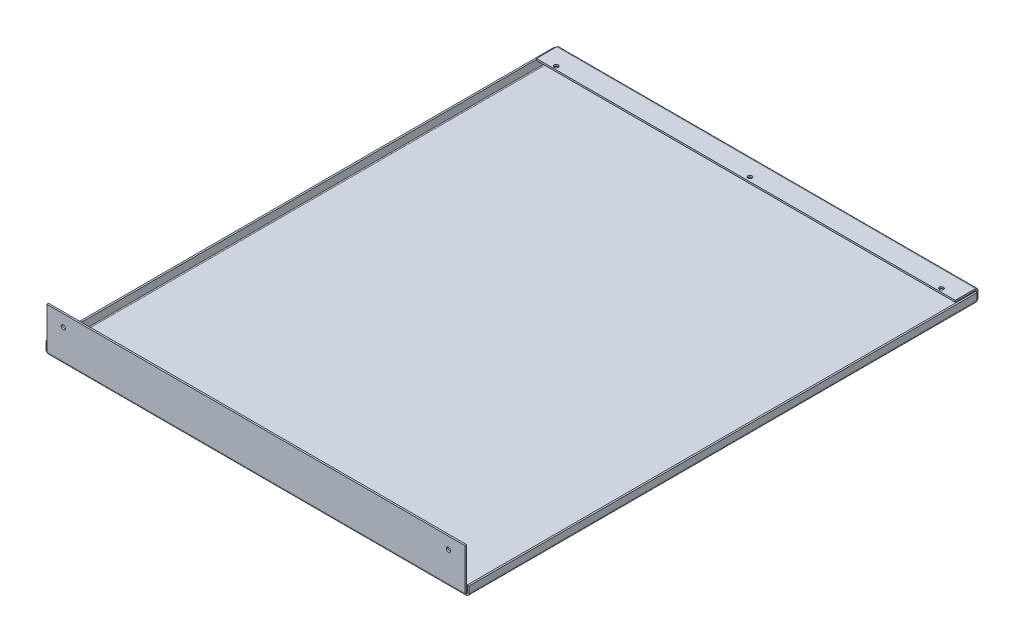
from build123d import *

# Parameters (mm, degrees)
SKETCH1_W                    = 498
SKETCH1_H                    = 604
BASE_FLANGE1_DEPTH           = 2
EDGE_FLANGE1_STRIP_W         = 10
EDGE_FLANGE1_STRIP_H         = 2
EDGE_FLANGE1_STRIP_CUT_DEPTH = 604
EDGE_FLANGE1_DEPTH           = 604
EDGE_FLANGE4_STRIP_W         = 10
EDGE_FLANGE4_STRIP_H         = 2
EDGE_FLANGE4_STRIP_CUT_DEPTH = 497
EDGE_FLANGE4_DEPTH           = 497
EDGE_FLANGE5_STRIP_W         = 10
EDGE_FLANGE5_STRIP_H         = 2
EDGE_FLANGE5_STRIP_CUT_DEPTH = 497
EDGE_FLANGE5_DEPTH           = 497
EDGE_FLANGE6_STRIP_W         = 10
EDGE_FLANGE6_STRIP_H         = 2
EDGE_FLANGE6_STRIP_CUT_DEPTH = 603
EDGE_FLANGE6_DEPTH           = 603
EDGE_FLANGE7_STRIP_W         = 10
EDGE_FLANGE7_STRIP_H         = 2
EDGE_FLANGE7_STRIP_CUT_DEPTH = 496
EDGE_FLANGE7_DEPTH           = 496
SKETCH37_R                   = 2.5
CUT_EXTRUDE2_DEPTH           = 2
SKETCH38_R                   = 2.5
CUT_EXTRUDE3_DEPTH           = 660.824976793
SKETCH39_R                   = 2.5
CUT_EXTRUDE4_DEPTH           = 10


# Sheet-metal steps are written as plain solids
with BuildPart() as part:
    # Sketch1 → Base-Flange1 (new body)
    with BuildSketch(Plane(origin=(0, 0, 0), x_dir=(1, 0, 0), z_dir=(0, 1, 0))):
        Rectangle(SKETCH1_W, SKETCH1_H)
    extrude(amount=BASE_FLANGE1_DEPTH)

    # Edge-Flange1 strip (across the edge) → Edge-Flange1 strip cut (cut)
    with BuildSketch(Plane(origin=(-249, 2, -302), x_dir=(1, 0, 0), z_dir=(0, 0, 1))):
        with Locations((-4, -1)):
            Rectangle(EDGE_FLANGE1_STRIP_W, EDGE_FLANGE1_STRIP_H)
    extrude(amount=EDGE_FLANGE1_STRIP_CUT_DEPTH, mode=Mode.SUBTRACT)

    # Edge-Flange1 section (across the edge) → Edge-Flange1 (add)
    with BuildSketch(Plane(origin=(-249, 2, -302), x_dir=(1, 0, 0), z_dir=(0, 0, 1))):
        with BuildLine():
            Line((-2, 1), (-2, 10))
            Line((-2, 10), (0, 10))
            Line((0, 10), (0, 1))
            ThreePointArc((0, 1), (0.292893219, 0.292893219), (1, 0))
            Line((1, 0), (1, -2))
            ThreePointArc((1, -2), (-1.121320344, -1.121320344), (-2, 1))
        make_face()
    extrude(amount=EDGE_FLANGE1_DEPTH)

    # Edge-Flange4 strip (across the edge) → Edge-Flange4 strip cut (cut)
    with BuildSketch(Plane(origin=(249, 2, -302), x_dir=(0, 0, 1), z_dir=(-1, 0, 0))):
        with Locations((-4, -1)):
            Rectangle(EDGE_FLANGE4_STRIP_W, EDGE_FLANGE4_STRIP_H)
    extrude(amount=EDGE_FLANGE4_STRIP_CUT_DEPTH, mode=Mode.SUBTRACT)

    # Edge-Flange4 section (across the edge) → Edge-Flange4 (add)
    with BuildSketch(Plane(origin=(249, 2, -302), x_dir=(0, 0, 1), z_dir=(-1, 0, 0))):
        with BuildLine():
            Line((-2, 1), (-2, 10))
            Line((-2, 10), (0, 10))
            Line((0, 10), (0, 1))
            ThreePointArc((0, 1), (0.292893219, 0.292893219), (1, 0))
            Line((1, 0), (1, -2))
            ThreePointArc((1, -2), (-1.121320344, -1.121320344), (-2, 1))
        make_face()
    extrude(amount=EDGE_FLANGE4_DEPTH)

    # Edge-Flange5 strip (across the edge) → Edge-Flange5 strip cut (cut)
    with BuildSketch(Plane(origin=(249, 12, -302), x_dir=(0, -1, 0), z_dir=(-1, 0, 0))):
        with Locations((-4, -1)):
            Rectangle(EDGE_FLANGE5_STRIP_W, EDGE_FLANGE5_STRIP_H)
    extrude(amount=EDGE_FLANGE5_STRIP_CUT_DEPTH, mode=Mode.SUBTRACT)

    # Edge-Flange5 section (across the edge) → Edge-Flange5 (add)
    with BuildSketch(Plane(origin=(249, 12, -302), x_dir=(0, -1, 0), z_dir=(-1, 0, 0))):
        with BuildLine():
            Line((-2, 1), (-2, 25))
            Line((-2, 25), (0, 25))
            Line((0, 25), (0, 1))
            ThreePointArc((0, 1), (0.292893219, 0.292893219), (1, 0))
            Line((1, 0), (1, -2))
            ThreePointArc((1, -2), (-1.121320344, -1.121320344), (-2, 1))
        make_face()
    extrude(amount=EDGE_FLANGE5_DEPTH)

    # Edge-Flange6 strip (across the edge) → Edge-Flange6 strip cut (cut)
    with BuildSketch(Plane(origin=(249, 2, 302), x_dir=(-1, 0, 0), z_dir=(0, 0, -1))):
        with Locations((-4, -1)):
            Rectangle(EDGE_FLANGE6_STRIP_W, EDGE_FLANGE6_STRIP_H)
    extrude(amount=EDGE_FLANGE6_STRIP_CUT_DEPTH, mode=Mode.SUBTRACT)

    # Edge-Flange6 section (across the edge) → Edge-Flange6 (add)
    with BuildSketch(Plane(origin=(249, 2, 302), x_dir=(-1, 0, 0), z_dir=(0, 0, -1))):
        with BuildLine():
            Line((-2, 1), (-2, 9))
            Line((-2, 9), (0, 9))
            Line((0, 9), (0, 1))
            ThreePointArc((0, 1), (0.292893219, 0.292893219), (1, 0))
            Line((1, 0), (1, -2))
            ThreePointArc((1, -2), (-1.121320344, -1.121320344), (-2, 1))
        make_face()
    extrude(amount=EDGE_FLANGE6_DEPTH)

    # Edge-Flange7 strip (across the edge) → Edge-Flange7 strip cut (cut)
    with BuildSketch(Plane(origin=(-248, 2, 302), x_dir=(0, 0, -1), z_dir=(1, 0, 0))):
        with Locations((-4, -1)):
            Rectangle(EDGE_FLANGE7_STRIP_W, EDGE_FLANGE7_STRIP_H)
    extrude(amount=EDGE_FLANGE7_STRIP_CUT_DEPTH, mode=Mode.SUBTRACT)

    # Edge-Flange7 section (across the edge) → Edge-Flange7 (add)
    with BuildSketch(Plane(origin=(-248, 2, 302), x_dir=(0, 0, -1), z_dir=(1, 0, 0))):
        with BuildLine():
            Line((-2, 1), (-2, 50))
            Line((-2, 50), (0, 50))
            Line((0, 50), (0, 1))
            ThreePointArc((0, 1), (0.292893219, 0.292893219), (1, 0))
            Line((1, 0), (1, -2))
            ThreePointArc((1, -2), (-1.121320344, -1.121320344), (-2, 1))
        make_face()
    extrude(amount=EDGE_FLANGE7_DEPTH)

    # Sketch37 → Cut-Extrude2 (cut)
    with BuildSketch(Plane(origin=(0, 14, 0), x_dir=(1, 0, 0), z_dir=(0, 1, 0))):
        with Locations(Location((-228.5, 281, 0), (0, 0, 270))):
            Circle(SKETCH37_R)
        with Locations(Location((228.5, 281, 0), (0, 0, 270))):
            Circle(SKETCH37_R)
    extrude(amount=-CUT_EXTRUDE2_DEPTH, mode=Mode.SUBTRACT)

    # Sketch38 → Cut-Extrude3 (cut, through all)
    with BuildSketch(Plane.XY.offset(304)):
        with Locations((228.5, 38)):
            Circle(SKETCH38_R)
        with Locations(Location((-228.5, 38, 0), (0, 0, 270))):
            Circle(SKETCH38_R)
    extrude(amount=-CUT_EXTRUDE3_DEPTH, mode=Mode.SUBTRACT)

    # Sketch39 → Cut-Extrude4 (cut)
    with BuildSketch(Plane(origin=(0, 14, 0), x_dir=(1, 0, 0), z_dir=(0, 1, 0))):
        with Locations(Location((0.468438538, 282, 0), (0, 0, 270))):
            Circle(SKETCH39_R)
    extrude(amount=-CUT_EXTRUDE4_DEPTH, mode=Mode.SUBTRACT)


solid = part.part
